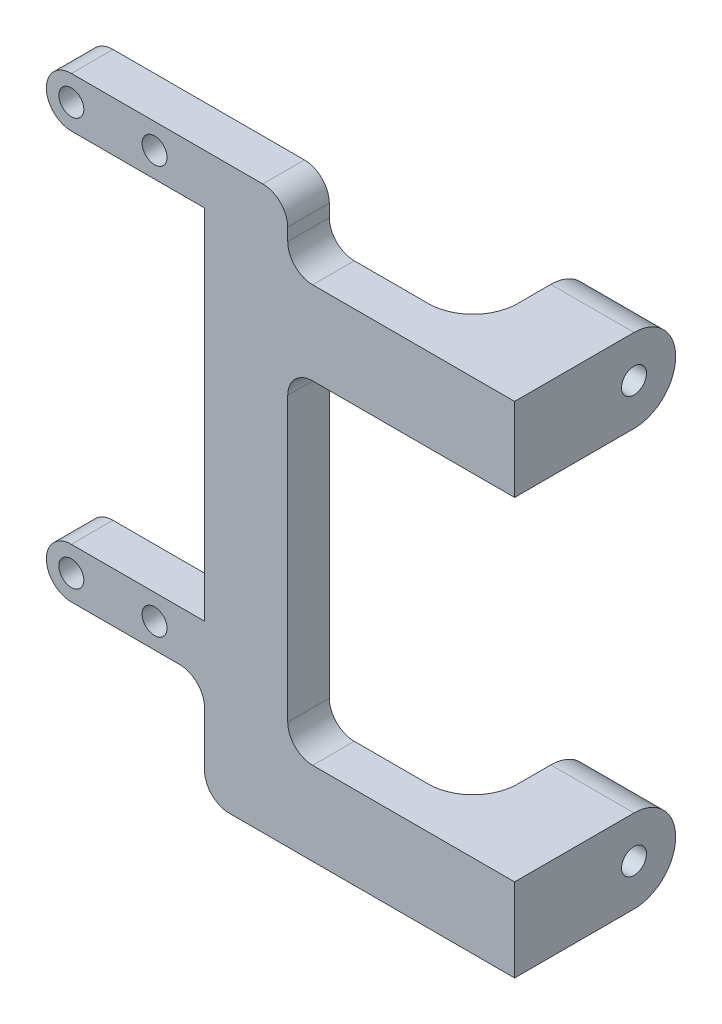
from build123d import *

# Parameters (mm, degrees)
SKETCH_1_R      = 1.5
EXTRUDE_1_DEPTH = 5
FILLET_1_R      = 3
SKETCH_2_W      = 14.35
SKETCH_2_H      = 10
SKETCH_2_R      = 1.5
EXTRUDE_2_DEPTH = 10
FILLET_2_R      = 5
FILLET_4_R      = 5.35


with BuildPart() as part:
    # 草图1 → 凸台-拉伸1 (new body)
    with BuildSketch(Plane.XY):
        Polygon((-3, 37.5), (-3, 31.5), (16, 31.5), (16, -11.5), (-3, -11.5), (-3, -17.5), (16, -17.5), (16, -30), (26, -30), (53.26, -30), (53.26, -20), (26, -20), (26, -17.5), (26, 20), (53.26, 20), (53.26, 30), (26, 30), (26, 37.5), align=None)
        with Locations((0, -14.5)):
            Circle(SKETCH_1_R, mode=Mode.SUBTRACT)
        with Locations((0, 34.5)):
            Circle(SKETCH_1_R, mode=Mode.SUBTRACT)
        with Locations((10, 34.5)):
            Circle(SKETCH_1_R, mode=Mode.SUBTRACT)
        with Locations((10, -14.5)):
            Circle(SKETCH_1_R, mode=Mode.SUBTRACT)
    extrude(amount=EXTRUDE_1_DEPTH)

    # 圆角1
    fillet_1_edges = [part.edges().sort_by_distance(p)[0] for p in [
        (26, 20, 2.5),
        (26, -20, 2.5),
        (26, 30, 2.5),
        (26, 37.5, 2.5),
        (16, -30, 2.5),
        (16, -17.5, 2.5),
        (-3, -17.5, 2.5),
        (-3, -11.5, 2.5),
        (-3, 37.5, 2.5),
        (-3, 31.5, 2.5),
    ]]
    fillet(fillet_1_edges, radius=FILLET_1_R - 0.0001)  # a hair under: the kernel refuses the full size

    # 草图2 → 凸台-拉伸2 (add)
    # profile 1 of 2: a face of its own
    with BuildSketch(Plane(origin=(53.26, 0, 0), x_dir=(0, 0, -1), z_dir=(1, 0, 0))):
        with Locations((7.175, 25)):
            Rectangle(SKETCH_2_W, SKETCH_2_H)
        with Locations((9.35, 25)):
            Circle(SKETCH_2_R, mode=Mode.SUBTRACT)
    # profile 2 of 2: a face of its own
    with BuildSketch(Plane(origin=(53.26, 0, 0), x_dir=(0, 0, -1), z_dir=(1, 0, 0))):
        with Locations((7.175, -25)):
            Rectangle(SKETCH_2_W, SKETCH_2_H)
        with Locations((9.35, -25)):
            Circle(SKETCH_2_R, mode=Mode.SUBTRACT)
    extrude(amount=-EXTRUDE_2_DEPTH)

    # 圆角2
    fillet_2_edges = [part.edges().sort_by_distance(p)[0] for p in [
        (48.26, 30, -14.35),
        (48.26, 20, -14.35),
        (48.26, -20, -14.35),
        (48.26, -30, -14.35),
    ]]
    fillet(fillet_2_edges, radius=FILLET_2_R - 0.0001)  # a hair under: the kernel refuses the full size

    # 圆角4
    fillet_4_edges = [part.edges().sort_by_distance(p)[0] for p in [
        (43.26, 25, 0),
        (43.26, -25, 0),
    ]]
    fillet(fillet_4_edges, radius=FILLET_4_R)


solid = part.part
